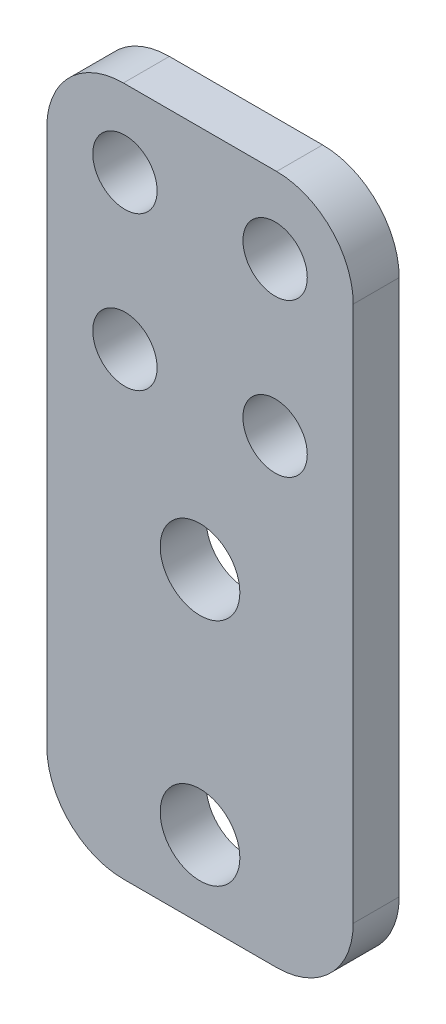
from build123d import *

# Parameters (mm, degrees)
SKETCH_2_W      = 20
SKETCH_2_H      = 45
SKETCH_2_R      = 2.1
SKETCH_2_R_2    = 2.6
EXTRUDE_1_DEPTH = 3
FILLET_1_R      = 5


with BuildPart() as part:
    # ｽｹｯﾁ2 → ﾎﾞｽ - 押し出し1 (new body)
    with BuildSketch(Plane.XY):
        with Locations((0, -12.5)):
            Rectangle(SKETCH_2_W, SKETCH_2_H)
        with Locations((-4.9, 5)):
            Circle(SKETCH_2_R, mode=Mode.SUBTRACT)
        with Locations((-4.9, -5)):
            Circle(SKETCH_2_R, mode=Mode.SUBTRACT)
        with Locations((4.9, -5)):
            Circle(SKETCH_2_R, mode=Mode.SUBTRACT)
        with Locations((4.9, 5)):
            Circle(SKETCH_2_R, mode=Mode.SUBTRACT)
        with Locations((0, -30)):
            Circle(SKETCH_2_R_2, mode=Mode.SUBTRACT)
        with Locations((0, -15)):
            Circle(SKETCH_2_R_2, mode=Mode.SUBTRACT)
    extrude(amount=EXTRUDE_1_DEPTH)

    # ﾌｨﾚｯﾄ1
    fillet_1_edges = [part.edges().sort_by_distance(p)[0] for p in [
        (-10, -35, 1.5),
        (10, -35, 1.5),
        (-10, 10, 1.5),
        (10, 10, 1.5),
    ]]
    fillet(fillet_1_edges, radius=FILLET_1_R)


solid = part.part
